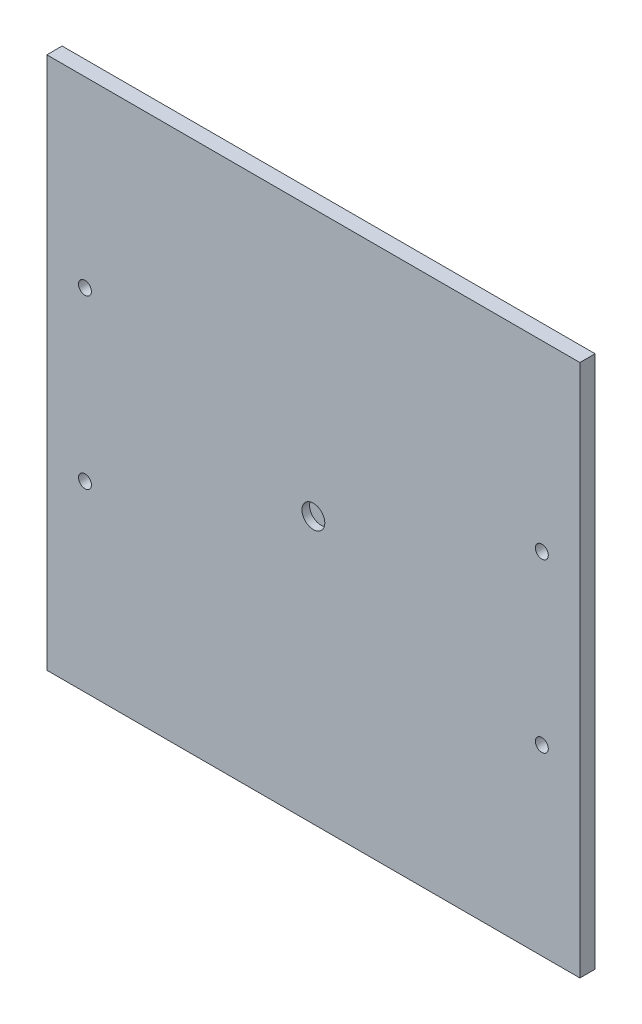
from build123d import *

# Parameters (mm, degrees)
SKETCH1_W                                       = 140
SKETCH1_H                                       = 140
BOSS_EXTRUDE1_DEPTH                             = 4
CSK_FOR_M3_FLAT_HEAD_MACHINE_SCREW1_D           = 3.4
CSK_FOR_M3_FLAT_HEAD_MACHINE_SCREW1_CSINK_D     = 6.3
CSK_FOR_M3_FLAT_HEAD_MACHINE_SCREW1_CSINK_ANGLE = 90
SKETCH8_R                                       = 3
CUT_EXTRUDE2_DEPTH                              = 2


with BuildPart() as part:
    # Sketch1 → Boss-Extrude1 (new body)
    with BuildSketch(Plane.XY):
        with Locations((70, 70)):
            Rectangle(SKETCH1_W, SKETCH1_H)
    extrude(amount=BOSS_EXTRUDE1_DEPTH)

    # CSK for M3 Flat Head Machine Screw1 (through all)
    with Locations(Plane(origin=(0, 0, 0), x_dir=(-1, 0, 0), z_dir=(0, 0, -1))):
        with Locations((-130, 92), (-130, 48), (-10, 92), (-10, 48)):
            CounterSinkHole(CSK_FOR_M3_FLAT_HEAD_MACHINE_SCREW1_D / 2, CSK_FOR_M3_FLAT_HEAD_MACHINE_SCREW1_CSINK_D / 2, counter_sink_angle=CSK_FOR_M3_FLAT_HEAD_MACHINE_SCREW1_CSINK_ANGLE)

    # Sketch8 → Cut-Extrude2 (cut)
    with BuildSketch(Plane(origin=(0, 0, 4), x_dir=(-1, 0, 0), z_dir=(0, 0, -1))):
        with Locations((-70, 70)):
            Circle(SKETCH8_R)
    extrude(amount=CUT_EXTRUDE2_DEPTH, mode=Mode.SUBTRACT)


solid = part.part
